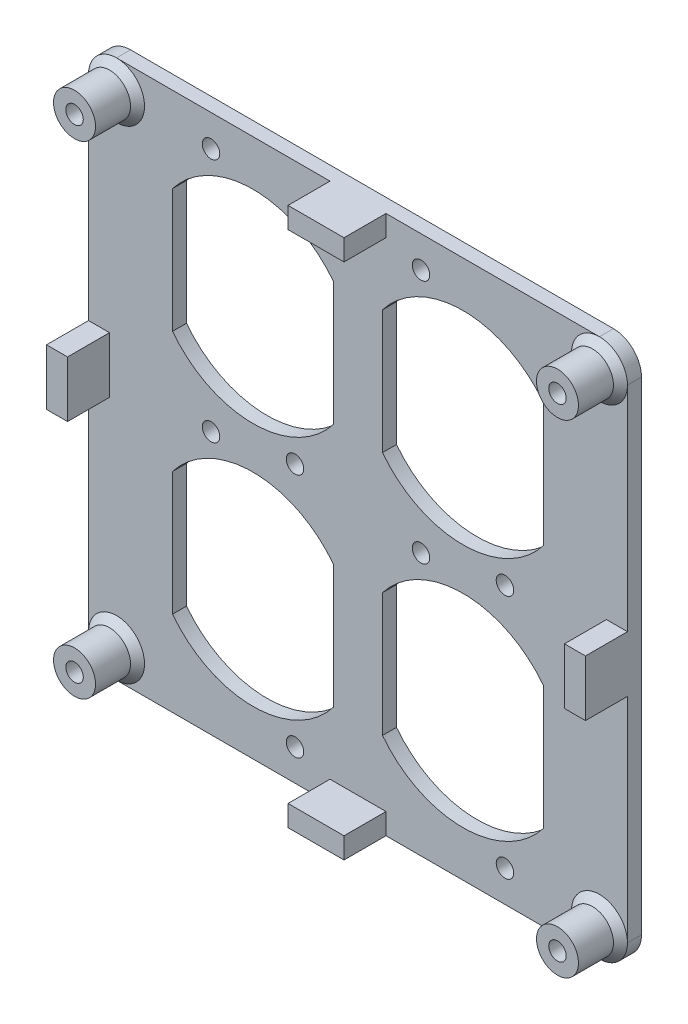
from build123d import *

# Parameters (mm, degrees)
SKETCH1_W               = 77
SKETCH1_H               = 77
BOSS_EXTRUDE1_DEPTH     = 2
CUT_EXTRUDE1_DEPTH      = 55.483942589
SKETCH3_R               = 1.25
CUT_EXTRUDE6_DEPTH      = 55.483942589
LPATTERN1_COUNT         = 2
LPATTERN1_PITCH         = 35
LPATTERN1_COUNT_DIR2    = 2
LPATTERN1_PITCH_DIR2    = 30
FILLET1_R               = 4
SKETCH25_R              = 3
BOSS_EXTRUDE4_DEPTH     = 6
SKETCH26_R              = 1.25
CUT_EXTRUDE9_DEPTH      = 3
MIRROR3_COPY_1_SKETCH_R = 3
MIRROR3_COPY_1_DEPTH    = 6
MIRROR3_COPY_2_SKETCH_R = 1.25
MIRROR3_COPY_2_DEPTH    = 3
CHAMFER1_SIZE           = 1
SKETCH27_W              = 3
SKETCH27_H              = 8
BOSS_EXTRUDE5_DEPTH     = 8
CIRPATTERN1_COUNT       = 4


with BuildPart() as part:
    # Sketch1 → Boss-Extrude1 (new body)
    with BuildSketch(Plane.XY):
        Rectangle(SKETCH1_W, SKETCH1_H)
    extrude(amount=BOSS_EXTRUDE1_DEPTH)

    # Sketch2 → Cut-Extrude1 (cut, through all)
    with BuildSketch(Plane.XY.offset(2)):
        with BuildLine():
            Line((-26.5, 8.668239134), (-26.5, 26.331760866))
            ThreePointArc((-26.5, 26.331760866), (-15, 32), (-3.5, 26.331760866))
            Line((-3.5, 26.331760866), (-3.5, 8.668239134))
            ThreePointArc((-3.5, 8.668239134), (-15, 3), (-26.5, 8.668239134))
        make_face()
    cut_extrude1 = extrude(amount=-CUT_EXTRUDE1_DEPTH, mode=Mode.SUBTRACT)

    # Sketch3 → Cut-Extrude6 (cut, through all)
    with BuildSketch(Plane.XY.offset(2)):
        with Locations((-21, 34)):
            Circle(SKETCH3_R)
        with Locations((-9, 1)):
            Circle(SKETCH3_R)
    cut_extrude6 = extrude(amount=-CUT_EXTRUDE6_DEPTH, mode=Mode.SUBTRACT)

    # LPattern1: Cut-Extrude1, Cut-Extrude6 2 × 2
    with Locations(*[(j * LPATTERN1_PITCH_DIR2, -i * LPATTERN1_PITCH, 0) for i in range(LPATTERN1_COUNT) for j in range(LPATTERN1_COUNT_DIR2) if (i, j) != (0, 0)]):
        add(cut_extrude1, mode=Mode.SUBTRACT)
        add(cut_extrude6, mode=Mode.SUBTRACT)

    # Fillet1
    fillet1_edges = [part.edges().sort_by_distance(p)[0] for p in [
        (38.5, -38.5, 1),
        (-38.5, -38.5, 1),
        (-38.5, 38.5, 1),
        (38.5, 38.5, 1),
    ]]
    fillet(fillet1_edges, radius=FILLET1_R)

    # Sketch25 → Boss-Extrude4 (add)
    with BuildSketch(Plane.XY.offset(2)):
        with Locations(Location((-34.5, 34.5, 0), (0, 0, 180))):
            Circle(SKETCH25_R)
    boss_extrude4 = extrude(amount=BOSS_EXTRUDE4_DEPTH)

    # Sketch26 → Cut-Extrude9 (cut)
    with BuildSketch(Plane.XY.offset(8)):
        with Locations((-34.5, 34.5)):
            Circle(SKETCH26_R)
    cut_extrude9 = extrude(amount=-CUT_EXTRUDE9_DEPTH, mode=Mode.SUBTRACT)

    # Mirror2: Boss-Extrude4, Cut-Extrude9 across plane
    add(boss_extrude4.mirror(Plane(origin=(0, 0, 0), x_dir=(0, 0, 1), z_dir=(1, 0, 0))))
    add(cut_extrude9.mirror(Plane(origin=(0, 0, 0), x_dir=(0, 0, 1), z_dir=(1, 0, 0))), mode=Mode.SUBTRACT)

    # Mirror3: Boss-Extrude4, Cut-Extrude9 across plane
    add(boss_extrude4.mirror(Plane.ZX))
    add(cut_extrude9.mirror(Plane.ZX), mode=Mode.SUBTRACT)

    # Mirror3 copy 1 sketch → Mirror3 copy 1 (add)
    with BuildSketch(Plane(origin=(0, 0, 2), x_dir=(-1, 0, 0), z_dir=(0, 0, 1))):
        with Locations(Location((-34.5, 34.5, 0), (0, 0, 180))):
            Circle(MIRROR3_COPY_1_SKETCH_R)
    extrude(amount=MIRROR3_COPY_1_DEPTH)

    # Mirror3 copy 2 sketch → Mirror3 copy 2 (cut)
    with BuildSketch(Plane(origin=(0, 0, 8), x_dir=(-1, 0, 0), z_dir=(0, 0, 1))):
        with Locations((-34.5, 34.5)):
            Circle(MIRROR3_COPY_2_SKETCH_R)
    extrude(amount=-MIRROR3_COPY_2_DEPTH, mode=Mode.SUBTRACT)

    # Chamfer1
    chamfer1_edges = [part.edges().sort_by_distance(p)[0] for p in [
        (-31.5, 34.5, 2),
        (31.5, 34.5, 2),
        (31.5, -34.5, 2),
        (-31.5, -34.5, 2),
    ]]
    chamfer(chamfer1_edges, length=CHAMFER1_SIZE - 0.0001)  # a hair under: the kernel refuses the full size

    # Sketch27 → Boss-Extrude5 (add)
    with BuildSketch(Plane.XY):
        with Locations((37, 0)):
            Rectangle(SKETCH27_W, SKETCH27_H)
    boss_extrude5 = extrude(amount=BOSS_EXTRUDE5_DEPTH)

    # CirPattern1: Boss-Extrude5 ×4 about axis
    cirpattern1_axis = Axis((0, 0, 0), (0, 0, 1))
    for i in range(1, CIRPATTERN1_COUNT):
        add(boss_extrude5.rotate(cirpattern1_axis, i * 360 / CIRPATTERN1_COUNT))


solid = part.part
